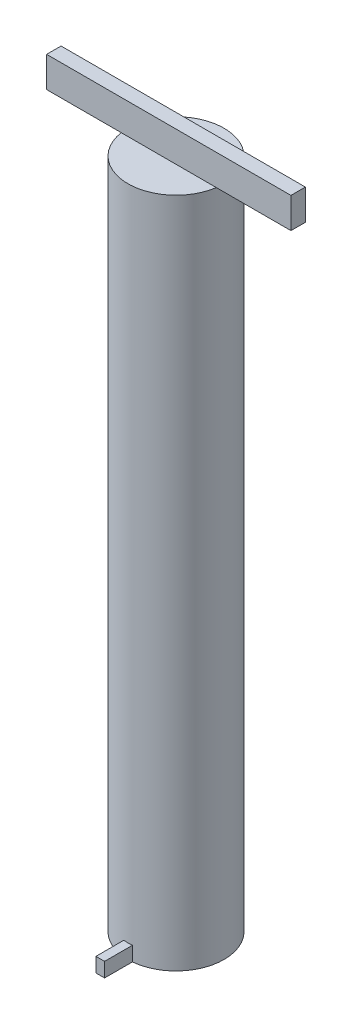
from build123d import *

# Parameters (mm, degrees)
SKETCH1_R           = 10
BOSS_EXTRUDE1_DEPTH = 139.7
BOSS_EXTRUDE2_DEPTH = 3
SKETCH4_W           = 50.8
SKETCH4_H           = 3
BOSS_EXTRUDE3_DEPTH = 6.35
SKETCH5_R           = 8
CUT_EXTRUDE1_DEPTH  = 2.54


with BuildPart() as part:
    # Sketch1 → Boss-Extrude1 (new body)
    with BuildSketch(Plane(origin=(0, 0, 0), x_dir=(1, 0, 0), z_dir=(0, 1, 0))):
        Circle(SKETCH1_R)
    extrude(amount=BOSS_EXTRUDE1_DEPTH)

    # Sketch3 → Boss-Extrude2 (add)
    with BuildSketch(Plane.XZ):
        with BuildLine():
            Line((-0.9, 15.75), (0.9, 15.75))
            Line((0.9, 15.75), (0.9, 9.354806465))
            ThreePointArc((0.9, 9.354806465), (0, 9.398), (-0.9, 9.354806465))
            Line((-0.9, 9.354806465), (-0.9, 15.75))
        make_face()
    extrude(amount=-BOSS_EXTRUDE2_DEPTH)

    # Sketch4 → Boss-Extrude3 (add)
    with BuildSketch(Plane(origin=(0, 139.7, 0), x_dir=(1, 0, 0), z_dir=(0, 1, 0))):
        Rectangle(SKETCH4_W, SKETCH4_H)
    extrude(amount=BOSS_EXTRUDE3_DEPTH)

    # Sketch5 → Cut-Extrude1 (cut)
    with BuildSketch(Plane.XZ):
        Circle(SKETCH5_R)
    extrude(amount=-CUT_EXTRUDE1_DEPTH, mode=Mode.SUBTRACT)


solid = part.part
